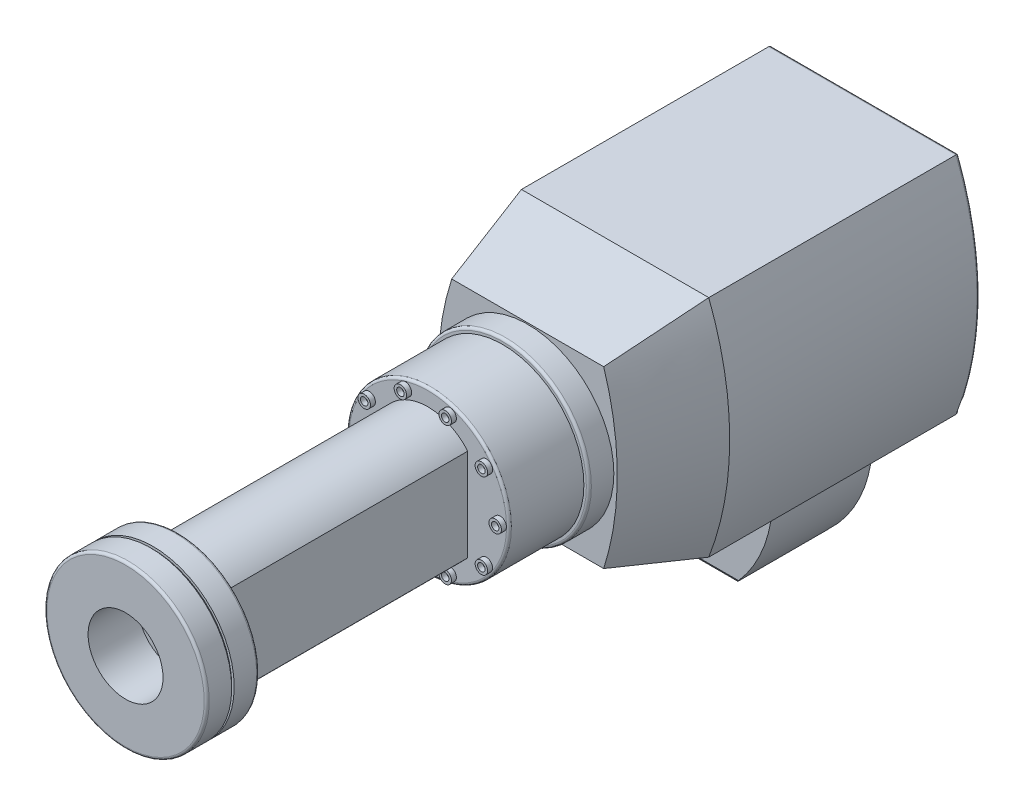
from build123d import *

# Parameters (mm, degrees)
BOSS_EXTRUDE1_DEPTH  = 100
SKETCH4_R            = 34.5
BOSS_EXTRUDE2_DEPTH  = 10
SKETCH5_R            = 32.5
BOSS_EXTRUDE3_DEPTH  = 30
SKETCH6_R            = 2.5
SKETCH6_R_2          = 1.5
BOSS_EXTRUDE4_DEPTH  = 2
CIRPATTERN2_COUNT    = 10
BOSS_EXTRUDE5_DEPTH  = 100
SKETCH8_R            = 32.5
BOSS_EXTRUDE6_DEPTH  = 10
SKETCH9_R            = 31.5
BOSS_EXTRUDE7_DEPTH  = 1
SKETCH10_R           = 32.5
BOSS_EXTRUDE8_DEPTH  = 10
SKETCH11_R           = 42.5
BOSS_EXTRUDE9_DEPTH  = 10.5
BOSS_EXTRUDE10_DEPTH = 35
BOSS_EXTRUDE11_DEPTH = 20
CUT_EXTRUDE1_DEPTH   = 40
CUT_EXTRUDE2_DEPTH   = 40
FILLET1_R            = 1
FILLET2_R            = 1
FILLET3_R            = 1
FILLET4_R            = 1
SKETCH17_R           = 15
CUT_EXTRUDE3_DEPTH   = 20
SKETCH18_R           = 15
CUT_EXTRUDE4_DEPTH   = 20


with BuildPart() as part:
    # Sketch1 → Boss-Extrude1 (new body)
    with BuildSketch(Plane.XY):
        with BuildLine():
            Line((-37.5, 45), (37.5, 45))
            ThreePointArc((37.5, 45), (45.880962103, 0), (37.5, -45))
            Line((37.5, -45), (-37.5, -45))
            ThreePointArc((-37.5, -45), (-45.880962103, 0), (-37.5, 45))
        make_face()
    extrude(amount=BOSS_EXTRUDE1_DEPTH)

    # Sketch2 for Loft1 → Loft1 section 0
    with BuildSketch(Plane.XY.offset(100)):
        with BuildLine():
            Line((-37.5, -45), (37.5, -45))
            # circular arc as an exact rational Bezier (weights 1, cos(half-angle), 1)
            Bezier((37.5, -45), (54.864231746, 0), (37.5, 45), weights=[1, 0.932952303, 1])
            Line((37.5, 45), (-37.5, 45))
            Bezier((-37.5, 45), (-54.864231746, 0), (-37.5, -45), weights=[1, 0.932952303, 1])
        make_face()
    # Sketch3 for Loft1 → Loft1 section 1
    with BuildSketch(Plane.XY.offset(135)):
        with BuildLine():
            Line((30.425473604, 35), (-30.425473604, 35))
            Bezier((-30.425473604, 35), (-41.608142487, 0), (-30.425473604, -35), weights=[1, 0.95256097, 1])
            Line((-30.425473604, -35), (30.425473604, -35))
            Bezier((30.425473604, -35), (41.608142487, 0), (30.425473604, 35), weights=[1, 0.95256097, 1])
        make_face()
    loft()

    # Sketch4 → Boss-Extrude2 (add)
    with BuildSketch(Plane.XY.offset(135)):
        Circle(SKETCH4_R)
    extrude(amount=BOSS_EXTRUDE2_DEPTH)

    # Sketch5 → Boss-Extrude3 (add)
    with BuildSketch(Plane.XY.offset(145)):
        Circle(SKETCH5_R)
    extrude(amount=BOSS_EXTRUDE3_DEPTH)

    # Sketch6 → Boss-Extrude4 (add)
    with BuildSketch(Plane.XY.offset(175)):
        with Locations((29, 0)):
            Circle(SKETCH6_R)
        with Locations((29, 0)):
            Circle(SKETCH6_R_2, mode=Mode.SUBTRACT)
    boss_extrude4 = extrude(amount=BOSS_EXTRUDE4_DEPTH)

    # CirPattern2: Boss-Extrude4 ×10 about axis
    cirpattern2_axis = Axis((0, 0, 0), (0, 0, 1))
    for i in range(1, CIRPATTERN2_COUNT):
        add(boss_extrude4.rotate(cirpattern2_axis, i * 360 / CIRPATTERN2_COUNT))

    # Sketch7 → Boss-Extrude5 (add)
    with BuildSketch(Plane.XY.offset(175)):
        with BuildLine():
            Line((16, 18.5), (16, -18.5))
            ThreePointArc((16, -18.5), (0, -25.898529491), (-16, -18.5))
            Line((-16, -18.5), (-16, 18.5))
            ThreePointArc((-16, 18.5), (0, 25.898529491), (16, 18.5))
        make_face()
    extrude(amount=BOSS_EXTRUDE5_DEPTH)

    # Sketch8 → Boss-Extrude6 (add)
    with BuildSketch(Plane.XY.offset(275)):
        Circle(SKETCH8_R)
    extrude(amount=BOSS_EXTRUDE6_DEPTH)

    # Sketch9 → Boss-Extrude7 (add)
    with BuildSketch(Plane.XY.offset(285)):
        Circle(SKETCH9_R)
    extrude(amount=BOSS_EXTRUDE7_DEPTH)

    # Sketch10 → Boss-Extrude8 (add)
    with BuildSketch(Plane.XY.offset(286)):
        Circle(SKETCH10_R)
    extrude(amount=BOSS_EXTRUDE8_DEPTH)

    # Sketch11 → Boss-Extrude9 (add, symmetric)
    with BuildSketch(Plane(origin=(-37.5, 0, 0), x_dir=(0, 0, -1), z_dir=(1, 0, 0))):
        with Locations((-50, -45)):
            Circle(SKETCH11_R)
    extrude(amount=BOSS_EXTRUDE9_DEPTH, both=True)

    # Sketch12 → Boss-Extrude10 (add)
    with BuildSketch(Plane(origin=(-27, 0, 0), x_dir=(0, 0, -1), z_dir=(1, 0, 0))):
        with BuildLine():
            Line((-70, -45), (-70, -77.164968675))
            ThreePointArc((-70, -77.164968675), (-50, -87.2938209), (-30, -77.164968675))
            Line((-30, -77.164968675), (-30, -45))
            Line((-30, -45), (-70, -45))
        make_face()
    extrude(amount=BOSS_EXTRUDE10_DEPTH)

    # Sketch13 → Boss-Extrude11 (add, symmetric)
    with BuildSketch(Plane.XY.offset(50)):
        with BuildLine():
            Line((8, -45), (8, -87))
            ThreePointArc((8, -87), (25.421855105, -68.929675658), (33, -45))
            Line((33, -45), (8, -45))
        make_face()
    extrude(amount=BOSS_EXTRUDE11_DEPTH, both=True)

    # Sketch15 → Cut-Extrude1 (cut)
    with BuildSketch(Plane.ZY.offset(-8)):
        with BuildLine():
            Line((70, -87), (70, -77.164968675))
            ThreePointArc((70, -77.164968675), (62.879246123, -83.689035336), (53.806975482, -87))
            Line((53.806975482, -87), (70, -87))
        make_face()
    extrude(amount=-CUT_EXTRUDE1_DEPTH, mode=Mode.SUBTRACT)

    # Sketch16 → Cut-Extrude2 (cut)
    with BuildSketch(Plane.ZY.offset(-8)):
        with BuildLine():
            Line((30, -87), (46.193024518, -87))
            ThreePointArc((46.193024518, -87), (37.120753877, -83.689035336), (30, -77.164968675))
            Line((30, -77.164968675), (30, -87))
        make_face()
    extrude(amount=-CUT_EXTRUDE2_DEPTH, mode=Mode.SUBTRACT)

    # Fillet1
    fillet1_edges = [part.edges().sort_by_distance(p)[0] for p in [
        (0, 45, 0),
        (45.880962103, 0, 0),
        (0, -45, 0),
        (-45.880962103, 0, 0),
    ]]
    fillet(fillet1_edges, radius=FILLET1_R)

    # Fillet2
    fillet2_edges = [part.edges().sort_by_distance(p)[0] for p in [
        (-48, -45, 92.5),
        (-27, -87.5, 50),
    ]]
    fillet(fillet2_edges, radius=FILLET2_R)

    # Fillet3
    fillet3_edges = [part.edges().sort_by_distance(p)[0] for p in [
        (-34.5, 0, 145),
        (-32.5, 0, 175),
    ]]
    fillet(fillet3_edges, radius=FILLET3_R - 0.0001)  # a hair under: the kernel refuses the full size

    # Fillet4
    fillet4_edges = [part.edges().sort_by_distance(p)[0] for p in [
        (-32.5, 0, 275),
        (-32.5, 0, 296),
    ]]
    fillet(fillet4_edges, radius=FILLET4_R)

    # Sketch17 → Cut-Extrude3 (cut)
    with BuildSketch(Plane.XY.offset(296)):
        Circle(SKETCH17_R)
    extrude(amount=-CUT_EXTRUDE3_DEPTH, mode=Mode.SUBTRACT)

    # Sketch18 → Cut-Extrude4 (cut)
    with BuildSketch(Plane.ZY.offset(48)):
        with Locations((50, -45)):
            Circle(SKETCH18_R)
    extrude(amount=-CUT_EXTRUDE4_DEPTH, mode=Mode.SUBTRACT)


solid = part.part
